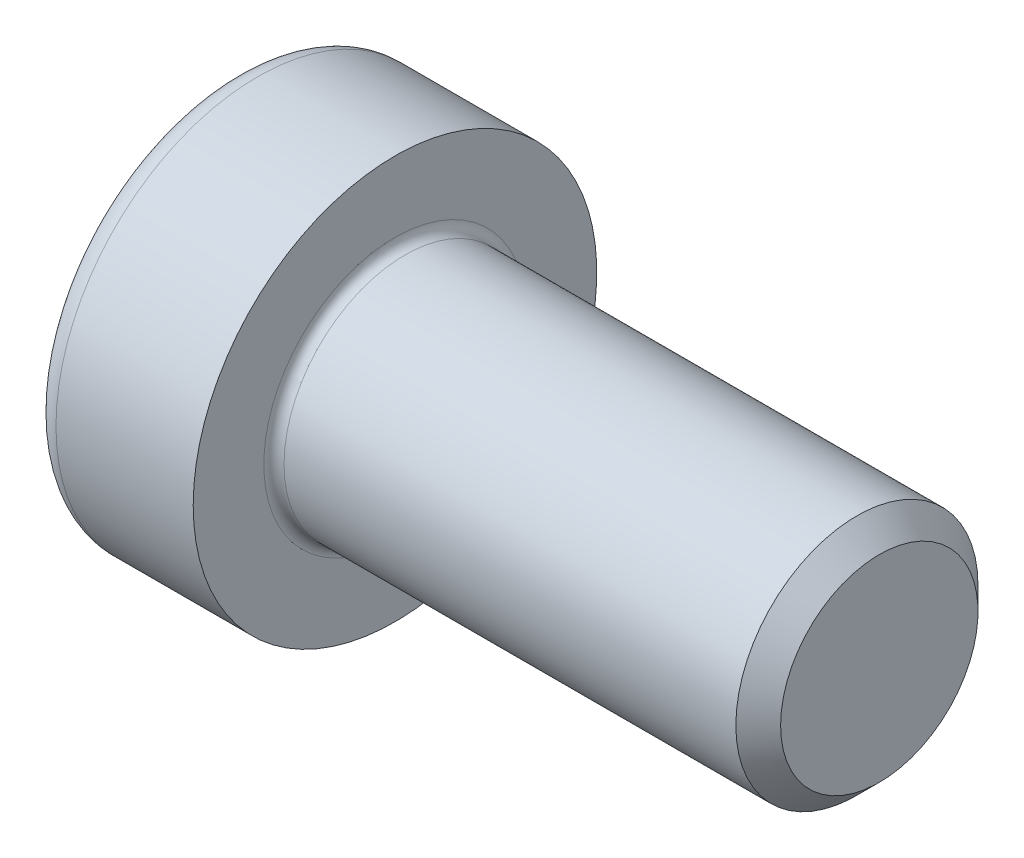
from build123d import *

# Parameters (mm, degrees)
FILLET1_R   = 0.25
FILLET2_R   = 0.6
HEX_2_DEPTH = 2.5


with BuildPart() as part:
    # BodySke → Base-Revolve (revolve)
    with BuildSketch(Plane.XY):
        Polygon((0, 0), (0, 5), (4, 5), (4, 3), (15.4455, 3), (16, 2.4455), (16, 0), align=None)
    revolve(axis=Axis((-31.75, 0, 0), (1, 0, 0)))

    # Fillet1
    fillet1_edges = [part.edges().sort_by_distance(p)[0] for p in [
        (4, -3, 0),
    ]]
    fillet(fillet1_edges, radius=FILLET1_R)

    # Fillet2
    fillet2_edges = [part.edges().sort_by_distance(p)[0] for p in [
        (0, -5, 0),
    ]]
    fillet(fillet2_edges, radius=FILLET2_R)

    # HexSke → Hex 2 (cut)
    with BuildSketch(Plane(origin=(0, 0, 0), x_dir=(0, 0.500000000000001, 0.866025403784438), z_dir=(-1, 0, 0))):
        Polygon((1.443375673, 2.5), (-1.443375673, 2.5), (-2.886751346, 0), (-1.443375673, -2.5), (1.443375673, -2.5), (2.886751346, 0), align=None)
    extrude(amount=-HEX_2_DEPTH, mode=Mode.SUBTRACT)

    # PilotSke → Hex-PreBroach (revolve, cut)
    with BuildSketch(Plane.XY):
        Polygon((0, 2.5), (2.5, 2.5), (3.077350269, 1.5), (5, 1.5), (5.866025404, 0), (0, 0), align=None)
    revolve(axis=Axis((0, 0, 0), (1, 0, 0)), mode=Mode.SUBTRACT)


solid = part.part
